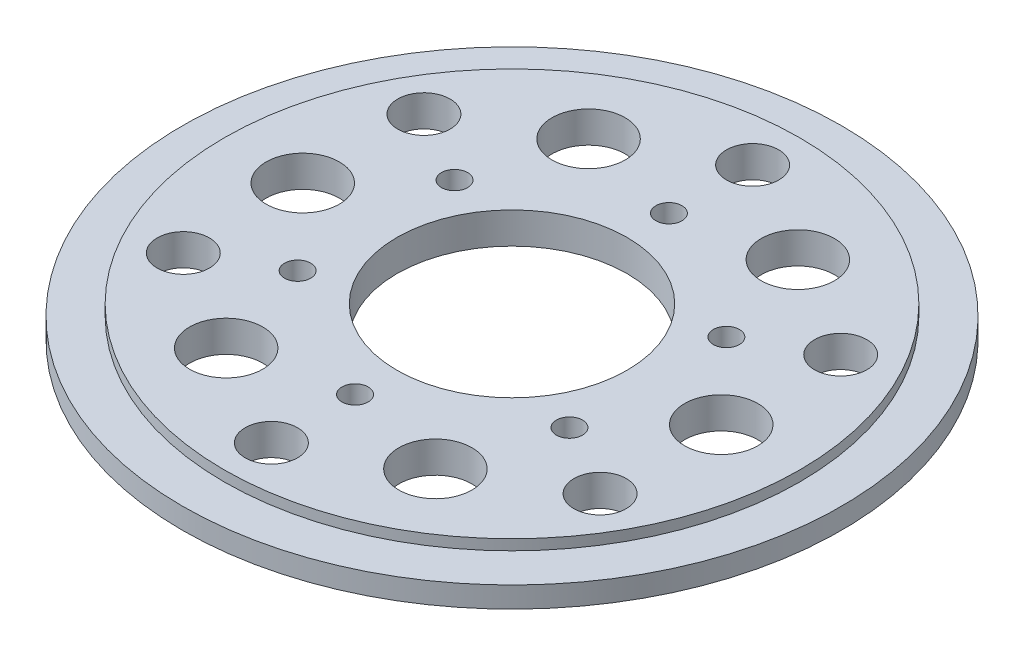
from build123d import *

# Parameters (mm, degrees)
SKETCH1_R             = 27.5
SKETCH1_R_2           = 11
BOSS_EXTRUDE1_DEPTH   = 3
SKETCH1_3_R           = 31.5
SKETCH1_3_R_2         = 27.5
BOSS_EXTRUDE2_DEPTH   = 2
M3X0_5_TAPPED_HOLE1_D = 2.5
SKETCH6_R             = 3.5
SKETCH6_R_2           = 2.5
CUT_EXTRUDE1_DEPTH    = 45.648628198
CIRPATTERN1_COUNT     = 6


with BuildPart() as part:
    # Sketch1 → Boss-Extrude1 (new body)
    with BuildSketch(Plane(origin=(0, 0, 0), x_dir=(1, 0, 0), z_dir=(0, 1, 0))):
        Circle(SKETCH1_R)
        Circle(SKETCH1_R_2, mode=Mode.SUBTRACT)
    extrude(amount=BOSS_EXTRUDE1_DEPTH)

    # Sketch1<3> → Boss-Extrude2 (add)
    with BuildSketch(Plane(origin=(0, 0, 0), x_dir=(1, 0, 0), z_dir=(0, 1, 0))):
        Circle(SKETCH1_3_R)
        Circle(SKETCH1_3_R_2, mode=Mode.SUBTRACT)
    extrude(amount=BOSS_EXTRUDE2_DEPTH)

    # M3x0.5 Tapped Hole1 (through all)
    with Locations(Plane(origin=(0, 3, 0), x_dir=(1, 0, 0), z_dir=(0, 1, 0))):
        with Locations((0, 15)):
            m3x0_5_tapped_hole1 = Hole(M3X0_5_TAPPED_HOLE1_D / 2)

    # Sketch6 → Cut-Extrude1 (cut, through all)
    with BuildSketch(Plane(origin=(0, 3, 0), x_dir=(1, 0, 0), z_dir=(0, 1, 0))):
        with Locations((20, 0)):
            Circle(SKETCH6_R)
        with Locations((0, 23)):
            Circle(SKETCH6_R_2)
    cut_extrude1 = extrude(amount=-CUT_EXTRUDE1_DEPTH, mode=Mode.SUBTRACT)

    # CirPattern1: M3x0.5 Tapped Hole1, Cut-Extrude1 ×6 about axis
    cirpattern1_axis = Axis((0, 3, 0), (0, -1, 0))
    add([m3x0_5_tapped_hole1.rotate(cirpattern1_axis, i * 360 / CIRPATTERN1_COUNT) for i in range(1, CIRPATTERN1_COUNT)], mode=Mode.SUBTRACT)
    add([cut_extrude1.rotate(cirpattern1_axis, i * 360 / CIRPATTERN1_COUNT) for i in range(1, CIRPATTERN1_COUNT)], mode=Mode.SUBTRACT)


solid = part.part
